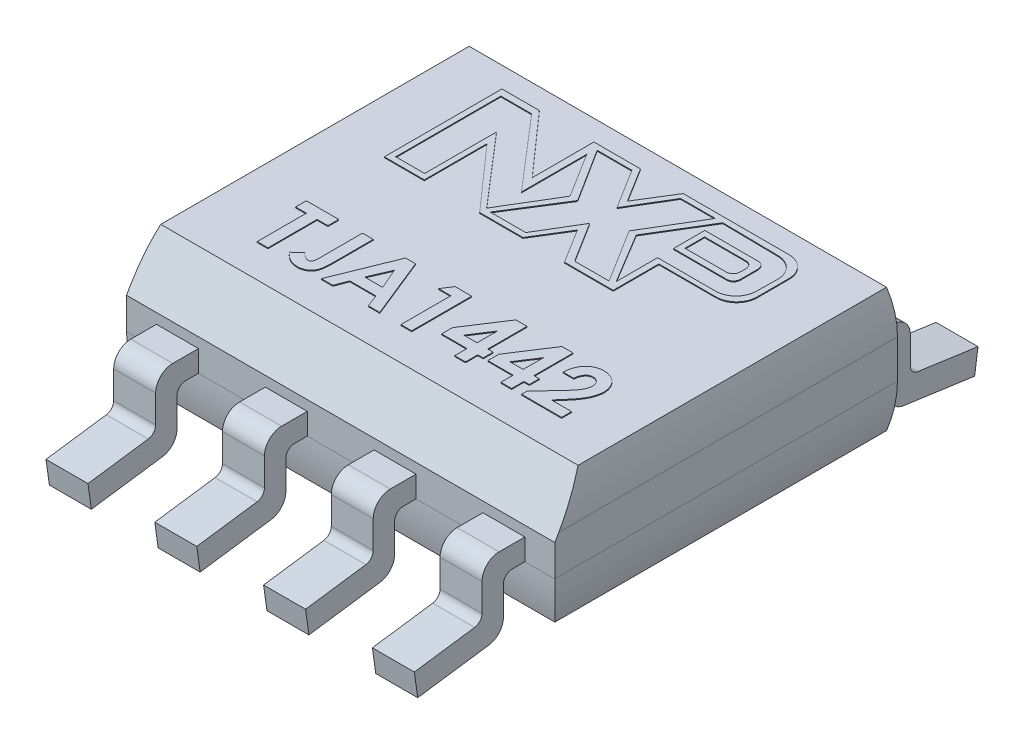
from build123d import *
from OCP.BRepAlgoAPI import BRepAlgoAPI_Cut
from OCP.TopTools import TopTools_ListOfShape

# Parameters (mm, degrees)
SKETCH1_W           = 5
SKETCH1_H           = 4
BOSS_EXTRUDE1_DEPTH = 1.45
CUT_EXTRUDE1_DEPTH  = 61.45
CUT_EXTRUDE2_DEPTH  = 61.45
BOSS_EXTRUDE2_DEPTH = 5
SKETCH7_W           = 0.35
SKETCH7_H           = 1.533953372
SKETCH7_W_2         = 0.78
SKETCH7_H_2         = 1.610570248
SKETCH7_H_3         = 1.782958217
SKETCH7_H_4         = 1.677610014
CUT_EXTRUDE3_DEPTH  = 61.45
BOSS_EXTRUDE3_DEPTH = 0.01
BOSS_EXTRUDE4_DEPTH = 0.01


with BuildPart() as part:
    # Sketch1 → Boss-Extrude1 (new body)
    with BuildSketch(Plane(origin=(0, 0, 0), x_dir=(1, 0, 0), z_dir=(0, 1, 0))):
        Rectangle(SKETCH1_W, SKETCH1_H)
    extrude(amount=BOSS_EXTRUDE1_DEPTH)

    # Sketch2 → Cut-Extrude1 (cut)
    with BuildSketch(Plane.ZY.offset(2.5)):
        Polygon((2, 0.86865368), (1.664359546, 1.45), (1.664359546, 1.731681291), (2.487143748, 1.731681291), (2.487143748, 0.86865368), align=None)
        with BuildLine():
            Line((-1.864420937, 1.672264495), (-2.155873567, 1.672264495))
            Line((-2.155873567, 1.672264495), (-2.155873567, 0.954004167))
            Line((-2.155873567, 0.954004167), (-1.999984404, 0.948389144))
            ThreePointArc((-1.999984404, 0.948389144), (-1.965805293, 1.316619369), (-1.864420937, 1.672264495))
        make_face()
        with BuildLine():
            Line((-1.999984404, 0.501610856), (-2.15587357, 0.501610856))
            Line((-2.15587357, 0.501610856), (-2.15587357, -0.22229559))
            Line((-2.15587357, -0.22229559), (-1.864420937, -0.222264495))
            ThreePointArc((-1.864420937, -0.222264495), (-1.965805293, 0.133380631), (-1.999984404, 0.501610856))
        make_face()
        with BuildLine():
            Line((2, 0.501548667), (2.487143748, 0.501548667))
            Line((2.487143748, 0.501548667), (2.487143748, -0.222291374))
            Line((2.487143748, -0.222291374), (1.864414025, -0.222322469))
            ThreePointArc((1.864414025, -0.222322469), (1.965809439, 0.133319505), (2, 0.501548667))
        make_face()
    extrude(amount=-CUT_EXTRUDE1_DEPTH, mode=Mode.SUBTRACT)


with BuildPart() as cut_extrude2_tool:
    # Sketch5 → Cut-Extrude2 (new body)
    with BuildSketch(Plane(origin=(0, 0, -2), x_dir=(-1, 0, 0), z_dir=(0, 0, -1))):
        with BuildLine():
            Line((-2.655873567, 0.954004878), (-2.499991937, 0.948390126))
            ThreePointArc((-2.499991937, 0.948390126), (-2.46581276, 1.316621068), (-2.364420937, 1.672264066))
            Line((-2.364420937, 1.672264066), (-2.655873567, 1.672264066))
            Line((-2.655873567, 1.672264066), (-2.655873567, 0.954004878))
        make_face()
        with BuildLine():
            ThreePointArc((-2.364420937, -0.222263785), (-2.46581276, 0.133379212), (-2.499991937, 0.501610155))
            Line((-2.499991937, 0.501610155), (-2.655873567, 0.495995403))
            Line((-2.65587357, 0.495995403), (-2.65587357, -0.22229488))
            Line((-2.65587357, -0.22229488), (-2.364420937, -0.222263785))
        make_face()
        with BuildLine():
            ThreePointArc((2.499991937, 0.948390126), (2.46581276, 1.316621068), (2.364420937, 1.672264066))
            Line((2.364420937, 1.672264066), (2.655873567, 1.672264066))
            Line((2.655873567, 1.672264066), (2.655873567, 0.954004878))
            Line((2.655873567, 0.954004878), (2.499991937, 0.948390126))
        make_face()
        with BuildLine():
            Line((2.499991937, 0.501610155), (2.65587357, 0.501610155))
            Line((2.65587357, 0.501610155), (2.65587357, -0.22229488))
            Line((2.65587357, -0.22229488), (2.364420937, -0.222263785))
            ThreePointArc((2.364420937, -0.222263785), (2.46581276, 0.133379212), (2.499991937, 0.501610155))
        make_face()
    extrude(amount=-CUT_EXTRUDE2_DEPTH)


with BuildPart() as part_1:
    add(part.part)

    # Cut-Extrude2: cut by cut_extrude2_tool, with a tolerance
    cut_extrude2_stock = TopTools_ListOfShape()
    cut_extrude2_stock.Append(part_1.part.wrapped)
    cut_extrude2_tools = TopTools_ListOfShape()
    cut_extrude2_tools.Append(cut_extrude2_tool.part.wrapped)
    cut_extrude2_cut = BRepAlgoAPI_Cut()
    cut_extrude2_cut.SetArguments(cut_extrude2_stock)
    cut_extrude2_cut.SetTools(cut_extrude2_tools)
    cut_extrude2_cut.SetFuzzyValue(0.00001)
    cut_extrude2_cut.Build()
    add(Compound.cast(cut_extrude2_cut.Shape()).solids(), mode=Mode.REPLACE)

    # Sketch6 → Boss-Extrude2 (add)
    with BuildSketch(Plane.ZY.offset(2.5)):
        with BuildLine():
            Line((2.300001958, 0.75), (2.253544498, 0.75))
            Line((2.253544498, 0.75), (-2.253544498, 0.75))
            Line((-2.253544498, 0.75), (-2.300001958, 0.75))
            ThreePointArc((-2.300001958, 0.75), (-2.441423314, 0.691421356), (-2.500001958, 0.55))
            Line((-2.500001958, 0.55), (-2.500001958, 0.227578594))
            ThreePointArc((-2.500001958, 0.227578594), (-2.524531, 0.161972691), (-2.586084648, 0.128551787))
            Line((-2.586084648, 0.128551787), (-3.290075098, 0.029612381))
            Line((-3.290075098, 0.029612381), (-3.250778141, -0.25))
            Line((-3.250778141, -0.25), (-2.422167338, -0.133546346))
            ThreePointArc((-2.422167338, -0.133546346), (-2.299060042, -0.066704538), (-2.250001958, 0.064507268))
            Line((-2.250001958, 0.064507268), (-2.250001958, 0.4))
            ThreePointArc((-2.250001958, 0.4), (-2.220712636, 0.470710678), (-2.150001958, 0.5))
            Line((-2.150001958, 0.5), (2.150001958, 0.5))
            ThreePointArc((2.150001958, 0.5), (2.220712636, 0.470710678), (2.250001958, 0.4))
            Line((2.250001958, 0.4), (2.250001958, 0.064507268))
            ThreePointArc((2.250001958, 0.064507268), (2.299060042, -0.066704538), (2.422167338, -0.133546346))
            Line((2.422167338, -0.133546346), (3.250778141, -0.25))
            Line((3.250778141, -0.25), (3.290075098, 0.029612381))
            Line((3.290075098, 0.029612381), (2.586084648, 0.128551787))
            ThreePointArc((2.586084648, 0.128551787), (2.524531, 0.161972691), (2.500001958, 0.227578594))
            Line((2.500001958, 0.227578594), (2.500001958, 0.55))
            ThreePointArc((2.500001958, 0.55), (2.441423314, 0.691421356), (2.300001958, 0.75))
        make_face()
    extrude(amount=-BOSS_EXTRUDE2_DEPTH)

    # Sketch7 → Cut-Extrude3 (cut)
    with BuildSketch(Plane(origin=(0, 1.45, 0), x_dir=(1, 0, 0), z_dir=(0, 1, 0))):
        with Locations((-2.325, -2.766976686)):
            Rectangle(SKETCH7_W, SKETCH7_H)
        with Locations((-1.27, -2.805285124)):
            Rectangle(SKETCH7_W_2, SKETCH7_H_2)
        with Locations((0, -2.805285124)):
            Rectangle(SKETCH7_W_2, SKETCH7_H_2)
        with Locations((2.325, -2.891479109)):
            Rectangle(SKETCH7_W, SKETCH7_H_3)
        with Locations((1.27, -2.838805007)):
            Rectangle(SKETCH7_W_2, SKETCH7_H_4)
        with Locations((1.27, 2.838805007)):
            Rectangle(SKETCH7_W_2, SKETCH7_H_4)
        with Locations((2.325, 2.891479109)):
            Rectangle(SKETCH7_W, SKETCH7_H_3)
        with Locations((0, 2.805285124)):
            Rectangle(SKETCH7_W_2, SKETCH7_H_2)
        with Locations((-1.27, 2.805285124)):
            Rectangle(SKETCH7_W_2, SKETCH7_H_2)
        with Locations((-2.325, 2.766976686)):
            Rectangle(SKETCH7_W, SKETCH7_H)
    extrude(amount=-CUT_EXTRUDE3_DEPTH, mode=Mode.SUBTRACT)

    # Sketch8 → Boss-Extrude3 (add)
    # profile 1 of 2: a face of its own
    with BuildSketch(Plane(origin=(0, 1.45, 0), x_dir=(1, 0, 0), z_dir=(0, 1, 0))):
        with BuildLine():
            Line((-1.803375496, 0.313929244), (-1.803375496, 1.686128651))
            Line((-1.803375496, 1.686128651), (-1.367177563, 1.686128651))
            Line((-1.367177563, 1.686128651), (-0.729512855, 0.965015135))
            Line((-0.729512855, 0.965015135), (-0.729512855, 1.686128651))
            Line((-0.729512855, 1.686128651), (-0.186049825, 1.686128651))
            Line((-0.186049825, 1.686128651), (0.063647762, 1.28357467))
            Line((0.063647762, 1.28357467), (0.31227987, 1.686128651))
            Line((0.31227987, 1.686128651), (1.548664193, 1.686128651))
            ThreePointArc((1.548664193, 1.686128651), (1.71836982, 1.615834278), (1.788664193, 1.446128651))
            Line((1.788664193, 1.446128651), (1.788664193, 1.073244082))
            ThreePointArc((1.788664193, 1.073244082), (1.71836982, 0.903538454), (1.548664193, 0.833244082))
            Line((1.548664193, 0.833244082), (0.881704624, 0.833244082))
            Line((0.881704624, 0.833244082), (0.881704624, 0.299873291))
            Line((0.881704624, 0.299873291), (0.31227987, 0.299873291))
            Line((0.31227987, 0.299873291), (0.063647762, 0.700709541))
            Line((0.063647762, 0.700709541), (-0.179553334, 0.306948774))
            Line((-0.179553334, 0.306948774), (-0.684190472, 0.306948774))
            Line((-0.684190472, 0.306948774), (-1.337736001, 1.046021375))
            Line((-1.337736001, 1.046021375), (-1.337736001, 0.313929244))
            Line((-1.337736001, 0.313929244), (-1.803375496, 0.313929244))
        make_face()
        Polygon((-1.737717167, 0.380080618), (-1.737717167, 1.607932124), (-1.378914568, 1.607932124), (-0.648130736, 0.758975413), (-0.648130736, 1.522116291), (-0.322062078, 0.999645994), (-0.687545107, 0.391434051), (-1.399882226, 1.218961086), (-1.399882226, 0.380080618), align=None, mode=Mode.SUBTRACT)
        Polygon((-0.627925102, 1.622168194), (-0.22215297, 1.622168194), (0.06797424, 1.157765207), (0.346386813, 1.622168194), (0.751426259, 1.622168194), (0.374330406, 0.993157662), (0.764288881, 0.368956019), (0.361905461, 0.368956019), (0.06797424, 0.839448039), (-0.211673984, 0.372983937), (-0.627925102, 0.372983937), (-0.233354138, 0.999645994), align=None, mode=Mode.SUBTRACT)
        with BuildLine():
            Line((0.838091157, 1.622168194), (1.493858319, 1.612977237))
            ThreePointArc((1.493858319, 1.612977237), (1.662562161, 1.540311479), (1.730471342, 1.369637398))
            Line((1.730471342, 1.369637398), (1.727040318, 1.124836692))
            ThreePointArc((1.727040318, 1.124836692), (1.655576174, 0.957309466), (1.487063887, 0.888200101))
            Line((1.487063887, 0.888200101), (0.811207804, 0.888200101))
            Line((0.811207804, 0.888200101), (0.811207804, 0.405870091))
            Line((0.811207804, 0.405870091), (0.45710645, 0.993157662))
            Line((0.45710645, 0.993157662), (0.838091157, 1.622168194))
        make_face(mode=Mode.SUBTRACT)
    # profile 2 of 2: a face of its own
    with BuildSketch(Plane(origin=(0, 1.45, 0), x_dir=(1, 0, 0), z_dir=(0, 1, 0))):
        with BuildLine():
            Line((0.811207804, 1.439616889), (1.43299067, 1.439616889))
            ThreePointArc((1.43299067, 1.439616889), (1.489559213, 1.416185432), (1.51299067, 1.359616889))
            Line((1.51299067, 1.359616889), (1.51299067, 1.153244082))
            ThreePointArc((1.51299067, 1.153244082), (1.489559213, 1.096675539), (1.43299067, 1.073244082))
            Line((1.43299067, 1.073244082), (0.811207804, 1.073244082))
            Line((0.811207804, 1.073244082), (0.811207804, 1.439616889))
        make_face()
        with BuildLine():
            Line((0.875476734, 1.373219945), (1.358258838, 1.373219945))
            ThreePointArc((1.358258838, 1.373219945), (1.41482738, 1.349788487), (1.438258838, 1.293219945))
            Line((1.438258838, 1.293219945), (1.438258838, 1.223991427))
            ThreePointArc((1.438258838, 1.223991427), (1.41482738, 1.167422884), (1.358258838, 1.143991427))
            Line((1.358258838, 1.143991427), (0.875476734, 1.143991427))
            Line((0.875476734, 1.143991427), (0.875476734, 1.373219945))
        make_face(mode=Mode.SUBTRACT)
    extrude(amount=BOSS_EXTRUDE3_DEPTH)

    # Sketch9 → Boss-Extrude4 (add)
    # profile 1 of 7: a face of its own
    with BuildSketch(Plane(origin=(0, 1.45, 0), x_dir=(1, 0, 0), z_dir=(0, 1, 0))):
        Polygon((-1.81434085, -0.586083303), (-1.437417773, -0.586083303), (-1.437417773, -0.711724328), (-1.563058799, -0.711724328), (-1.563058799, -1.286083303), (-1.688699825, -1.286083303), (-1.688699825, -0.711724328), (-1.81434085, -0.711724328), align=None)
    # profile 2 of 7: a face of its own
    with BuildSketch(Plane(origin=(0, 1.45, 0), x_dir=(1, 0, 0), z_dir=(0, 1, 0))):
        with BuildLine():
            Line((-1.159212645, -0.586083303), (-1.03357162, -0.586083303))
            Line((-1.03357162, -0.586083303), (-1.03357162, -1.050786828))
            add(Edge.make_bspline(
                [(-1.03357162, -1.050786828), (-1.033617683, -1.059668569), (-1.033706439, -1.076781931), (-1.034595042, -1.101418854), (-1.03579659, -1.124007236), (-1.037526935, -1.144510882), (-1.040096971, -1.162928802), (-1.043005471, -1.179306946), (-1.046214354, -1.19371205), (-1.051634945, -1.209833603), (-1.060050255, -1.227686389), (-1.072749198, -1.246969934), (-1.088563447, -1.26372405), (-1.106776238, -1.278276935), (-1.127541028, -1.289800068), (-1.150379444, -1.298129019), (-1.175218477, -1.303104792), (-1.192422632, -1.30371689), (-1.201279953, -1.304032021)],
                knots=[0, 0, 0, 0, 1.22248561, 2.355488409, 3.392943897, 4.335991845, 5.186735882, 5.951517034, 6.625683685, 7.215700098, 8.28923535, 9.333114649, 10.380102123, 11.447198135, 12.530158036, 13.633358744, 14.781567393, 16, 16, 16, 16], degree=3))
            add(Edge.make_bspline(
                [(-1.201279953, -1.304032021), (-1.210508476, -1.303746316), (-1.228710727, -1.303182795), (-1.255406203, -1.298383046), (-1.281063892, -1.290687603), (-1.305551055, -1.279560916), (-1.329203174, -1.265623237), (-1.351590985, -1.248334903), (-1.373181914, -1.228232102), (-1.385981148, -1.212805716), (-1.392545979, -1.204893399)],
                knots=[0, 0, 0, 0, 0.990984786, 1.954608977, 2.90473533, 3.862451285, 4.837525908, 5.848096122, 6.896271184, 8, 8, 8, 8], degree=3))
            Line((-1.392545979, -1.204893399), (-1.297473863, -1.116972726))
            add(Edge.make_bspline(
                [(-1.297473863, -1.116972726), (-1.292495995, -1.122601289), (-1.283181064, -1.133133845), (-1.269143738, -1.146868557), (-1.256481314, -1.157902812), (-1.24454484, -1.16586192), (-1.233280675, -1.171472202), (-1.222446464, -1.175513446), (-1.211704488, -1.17780102), (-1.204608011, -1.178197313), (-1.201139729, -1.178390995)],
                knots=[0, 0, 0, 0, 1.529509877, 2.862124173, 3.996688592, 4.944357383, 5.774364335, 6.554177287, 7.293378699, 8, 8, 8, 8], degree=3))
            add(Edge.make_bspline(
                [(-1.201139729, -1.178390995), (-1.197782817, -1.178215937), (-1.19132858, -1.177879359), (-1.182453757, -1.174137867), (-1.174971709, -1.168263568), (-1.170045971, -1.161510298), (-1.166906972, -1.154606639), (-1.164945666, -1.14793319), (-1.163084384, -1.139933535), (-1.161593166, -1.130611681), (-1.160466399, -1.119846038), (-1.159904787, -1.1077673), (-1.159221795, -1.094310196), (-1.159215804, -1.084909241), (-1.159212645, -1.079953495)],
                knots=[0, 0, 0, 0, 1.003927327, 1.930222208, 2.840933547, 3.835773585, 4.407906147, 5.114514582, 5.922289074, 6.876303333, 7.950072246, 9.174518422, 10.510537432, 12, 12, 12, 12], degree=3))
            Line((-1.159212645, -1.079953495), (-1.159212645, -0.586083303))
        make_face()
    # profile 3 of 7: a face of its own
    with BuildSketch(Plane(origin=(0, 1.45, 0), x_dir=(1, 0, 0), z_dir=(0, 1, 0))):
        Polygon((-0.656508318, -0.586083303), (-0.539981876, -0.586083303), (-0.257289568, -1.286083303), (-0.39148428, -1.286083303), (-0.445891331, -1.142493559), (-0.750879312, -1.142493559), (-0.805286363, -1.286083303), (-0.93934085, -1.286083303), align=None)
        Polygon((-0.598315209, -0.773843719), (-0.70320303, -1.016852533), (-0.493427389, -1.016852533), align=None, mode=Mode.SUBTRACT)
    # profile 4 of 7: a face of its own
    with BuildSketch(Plane(origin=(0, 1.45, 0), x_dir=(1, 0, 0), z_dir=(0, 1, 0))):
        Polygon((-0.079064408, -0.586083303), (0.115146329, -0.586083303), (0.115146329, -1.286083303), (-0.010494697, -1.286083303), (-0.010494697, -0.702749969), (-0.15408444, -0.702749969), align=None)
    # profile 5 of 7: a face of its own
    with BuildSketch(Plane(origin=(0, 1.45, 0), x_dir=(1, 0, 0), z_dir=(0, 1, 0))):
        Polygon((0.612381906, -0.568134585), (0.743351457, -0.568134585), (0.743351457, -1.025826892), (0.80617197, -1.025826892), (0.80617197, -1.142493559), (0.743351457, -1.142493559), (0.743351457, -1.286083303), (0.617710432, -1.286083303), (0.617710432, -1.142493559), (0.321556585, -1.142493559), (0.321556585, -1.015310065), align=None)
        Polygon((0.617710432, -1.025826892), (0.617710432, -0.787585706), (0.462762515, -1.025826892), align=None, mode=Mode.SUBTRACT)
    # profile 6 of 7: a face of its own
    with BuildSketch(Plane(origin=(0, 1.45, 0), x_dir=(1, 0, 0), z_dir=(0, 1, 0))):
        Polygon((1.150843444, -0.568134585), (1.281812996, -0.568134585), (1.281812996, -1.025826892), (1.344633509, -1.025826892), (1.344633509, -1.142493559), (1.281812996, -1.142493559), (1.281812996, -1.286083303), (1.15617197, -1.286083303), (1.15617197, -1.142493559), (0.860018124, -1.142493559), (0.860018124, -1.015310065), align=None)
        Polygon((1.15617197, -1.025826892), (1.15617197, -0.787585706), (1.001224053, -1.025826892), align=None, mode=Mode.SUBTRACT)
    # profile 7 of 7: a face of its own
    with BuildSketch(Plane(origin=(0, 1.45, 0), x_dir=(1, 0, 0), z_dir=(0, 1, 0))):
        with BuildLine():
            Line((1.542069406, -0.819416636), (1.41642838, -0.819416636))
            add(Edge.make_bspline(
                [(1.41642838, -0.819416636), (1.416971005, -0.809912557), (1.41803126, -0.791342157), (1.422248688, -0.764368058), (1.427899896, -0.738880499), (1.435442184, -0.714968641), (1.444919563, -0.692641171), (1.456088154, -0.671821975), (1.46923329, -0.652620665), (1.4840752, -0.635129842), (1.500361908, -0.619438663), (1.517755287, -0.605525878), (1.536521392, -0.594045397), (1.55631735, -0.584598025), (1.577139791, -0.577050014), (1.599185728, -0.572003557), (1.622264275, -0.568586048), (1.638063409, -0.568287002), (1.64611588, -0.568134585)],
                knots=[0, 0, 0, 0, 1.199038563, 2.342849363, 3.436047546, 4.486744587, 5.497670872, 6.488682221, 7.459191391, 8.424610317, 9.374430501, 10.305433194, 11.225809216, 12.140057399, 13.06607119, 14.010487599, 14.985989317, 16, 16, 16, 16], degree=3))
            add(Edge.make_bspline(
                [(1.64611588, -0.568134585), (1.656000174, -0.568443001), (1.675296632, -0.569045101), (1.703335916, -0.574181217), (1.729521542, -0.582772164), (1.753834475, -0.594775984), (1.776067734, -0.610025578), (1.796217634, -0.628208223), (1.813674808, -0.649705401), (1.82854994, -0.673622649), (1.840909398, -0.698947649), (1.849570391, -0.725134748), (1.855263168, -0.751489049), (1.855870338, -0.7692347), (1.85617197, -0.77805045)],
                knots=[0, 0, 0, 0, 1.075374347, 2.099382735, 3.09057751, 4.06680945, 5.040638231, 6.016817125, 7.011024321, 8.044445721, 9.0776792, 10.070479129, 11.0414456, 12, 12, 12, 12], degree=3))
            add(Edge.make_bspline(
                [(1.85617197, -0.77805045), (1.85605453, -0.783382838), (1.855818154, -0.794115619), (1.854174593, -0.81035695), (1.851708928, -0.826900645), (1.847991306, -0.843732519), (1.843355127, -0.86085729), (1.837730772, -0.878326206), (1.830987777, -0.896040225), (1.823238671, -0.914198716), (1.813993967, -0.932860632), (1.803229795, -0.952305723), (1.790660449, -0.972516738), (1.77643775, -0.993607797), (1.760492623, -1.015545635), (1.742747228, -1.038264168), (1.723405951, -1.06184345), (1.709678903, -1.077604876), (1.702626297, -1.085702694)],
                knots=[0, 0, 0, 0, 0.728284026, 1.46585585, 2.227944881, 3.01186502, 3.81876927, 4.650621989, 5.517437689, 6.406905708, 7.346299482, 8.360816762, 9.441613733, 10.596154504, 11.834900912, 13.145207542, 14.533280747, 16, 16, 16, 16], degree=3))
            Line((1.702626297, -1.085702694), (1.629569406, -1.169416636))
            Line((1.629569406, -1.169416636), (1.865146329, -1.169416636))
            Line((1.865146329, -1.169416636), (1.865146329, -1.286083303))
            Line((1.865146329, -1.286083303), (1.398479662, -1.286083303))
            Line((1.398479662, -1.286083303), (1.398479662, -1.222421444))
            Line((1.398479662, -1.222421444), (1.605731265, -1.001848527))
            add(Edge.make_bspline(
                [(1.605731265, -1.001848527), (1.611731731, -0.995414346), (1.623352856, -0.982953247), (1.639888518, -0.964652797), (1.654851831, -0.947286106), (1.667932519, -0.930668255), (1.67981704, -0.915338259), (1.689975464, -0.900834053), (1.698500732, -0.88728676), (1.70775612, -0.870951091), (1.716545696, -0.851467898), (1.724610664, -0.829022461), (1.72952682, -0.807569793), (1.730205405, -0.793590773), (1.730530944, -0.786884585)],
                knots=[0, 0, 0, 0, 1.246127091, 2.413378631, 3.493388633, 4.492180848, 5.408488754, 6.240484944, 6.999099869, 7.674939598, 8.898438119, 10.020720584, 11.050475521, 12, 12, 12, 12], degree=3))
            add(Edge.make_bspline(
                [(1.730530944, -0.786884585), (1.730287547, -0.780396864), (1.729815924, -0.767825866), (1.724633178, -0.749943688), (1.716603887, -0.733753201), (1.705289482, -0.719738196), (1.691584194, -0.708221136), (1.675746447, -0.699655071), (1.657905364, -0.694712491), (1.645398425, -0.694093856), (1.638964438, -0.69377561)],
                knots=[0, 0, 0, 0, 1.062038974, 2.057870785, 3.028805853, 4.01125022, 4.991535629, 5.949134679, 6.94496649, 8, 8, 8, 8], degree=3))
            add(Edge.make_bspline(
                [(1.638964438, -0.69377561), (1.635640559, -0.693893174), (1.629096968, -0.694124618), (1.619478402, -0.695665275), (1.610325645, -0.698380522), (1.601536822, -0.702018571), (1.59320573, -0.706840831), (1.585353382, -0.712785035), (1.577897045, -0.719700127), (1.570870915, -0.727564484), (1.56447622, -0.736341109), (1.558796475, -0.745949845), (1.554100271, -0.756384729), (1.549965563, -0.767508002), (1.546776678, -0.779439139), (1.544454774, -0.792106733), (1.542689586, -0.805490175), (1.542279893, -0.814690033), (1.542069406, -0.819416636)],
                knots=[0, 0, 0, 0, 0.903469896, 1.778625579, 2.63899355, 3.493148037, 4.358286772, 5.247621495, 6.164656832, 7.118446693, 8.109501108, 9.111810964, 10.146451449, 11.215617525, 12.33435995, 13.498009769, 14.714554818, 16, 16, 16, 16], degree=3))
        make_face()
    extrude(amount=BOSS_EXTRUDE4_DEPTH)


solid = part_1.part
